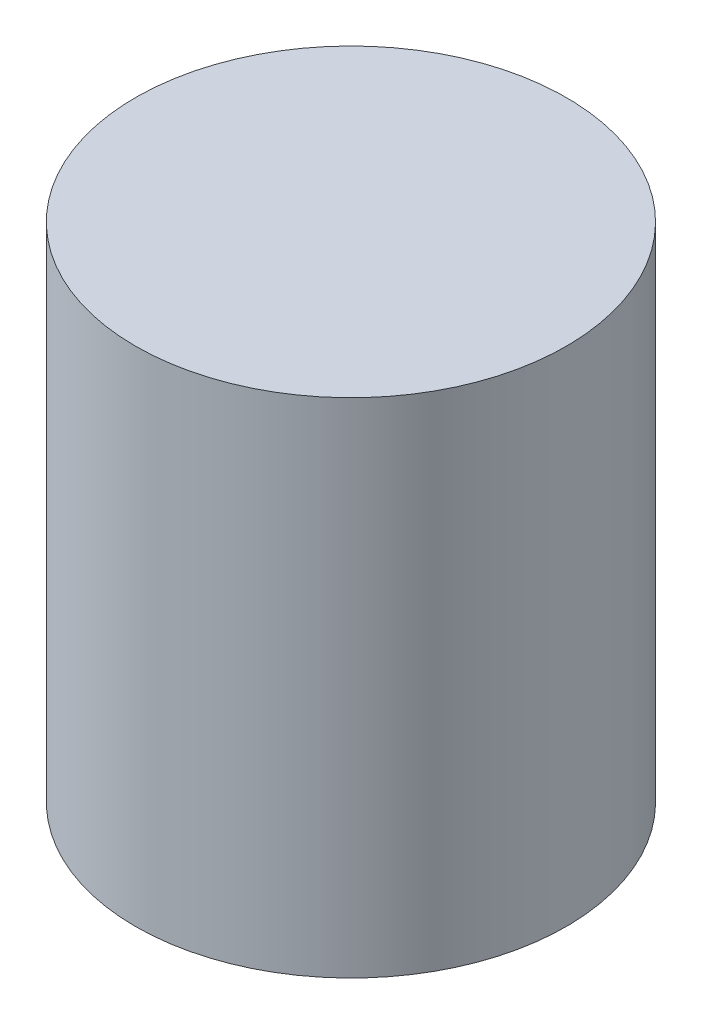
from build123d import *

# Parameters (mm, degrees)
SKETCH1_R           = 1.5
SKETCH1_R_2         = 0.5
BOSS_EXTRUDE1_DEPTH = 3
SKETCH2_R           = 1.5
BOSS_EXTRUDE2_DEPTH = 0.5
THREAD2_PITCH       = 0.25


with BuildPart() as part:
    # Sketch1 → Boss-Extrude1 (new body)
    with BuildSketch(Plane(origin=(0, 0, 0), x_dir=(1, 0, 0), z_dir=(0, 1, 0))):
        with Locations(Location((0, 0, 0), (0, 0, 270))):
            Circle(SKETCH1_R)
        with Locations(Location((0, 0, 0), (0, 0, 270))):
            Circle(SKETCH1_R_2, mode=Mode.SUBTRACT)
    extrude(amount=BOSS_EXTRUDE1_DEPTH)

    # Sketch2 → Boss-Extrude2 (add)
    with BuildSketch(Plane(origin=(0, 3, 0), x_dir=(1, 0, 0), z_dir=(0, 1, 0))):
        with Locations(Location((0, 0, 0), (0, 0, 270))):
            Circle(SKETCH2_R)
    extrude(amount=BOSS_EXTRUDE2_DEPTH)

    # Thread2: the profile of Thread Profile2 profile screwed along a right-hand helix of 12 turns, 6 arcs to a turn; built about Z, then put on its axis
    thread2_z = Axis((0, 0, 0), (0, 0, 1))
    thread2_corners = [(0.4997, 0, -0.000173205), (0.635316469, 0, 0.078125), (0.635316469, 0, 0.109375), (0.4997, 0, 0.187673204)]
    with BuildLine(mode=Mode.PRIVATE) as thread2_profile:
        Line(thread2_corners[0], thread2_corners[1])
        Line(thread2_corners[1], thread2_corners[2])
        Line(thread2_corners[2], thread2_corners[3])
        Line(thread2_corners[3], thread2_corners[0])
    thread2_cap = Face(thread2_profile.wire())
    thread2_turn_angles = [0, 30, 60, 90, 120, 150, 180, 210, 240, 270, 300, 330, 360]
    thread2_turn_weights = [1, 0.8660254037844387, 1, 0.8660254037844387, 1, 0.8660254037844387, 1, 0.8660254037844387, 1, 0.8660254037844387, 1, 0.8660254037844387, 1]
    thread2_turn_rails = [Edge.make_bspline([Vector(p[0], p[1], 0).rotate(thread2_z, thread2_turn_angles[k]) / thread2_turn_weights[k] + Vector(0, 0, p[2] + THREAD2_PITCH * thread2_turn_angles[k] / 360) for k in range(13)], [0, 0, 0, 1, 1, 2, 2, 3, 3, 4, 4, 5, 5, 6, 6, 6], 2, thread2_turn_weights) for p in thread2_corners]
    thread2_turn_sides = [Face.make_surface_from_curves(thread2_turn_rails[p[0]], thread2_turn_rails[p[1]]) for p in [(0, 1), (1, 2), (2, 3), (3, 0)]]
    thread2 = Plane(origin=(0, 0, 0), x_dir=(1, 0, 0), z_dir=(0, 1, 0)) * Solid(Shell([*[p.moved(Location((0, 0, THREAD2_PITCH * i))) for i in range(12) for p in thread2_turn_sides], thread2_cap, thread2_cap.rotate(thread2_z, 4320).moved(Location((0, 0, THREAD2_PITCH * 4320 / 360)))]))
    add(thread2, mode=Mode.SUBTRACT)


solid = part.part
